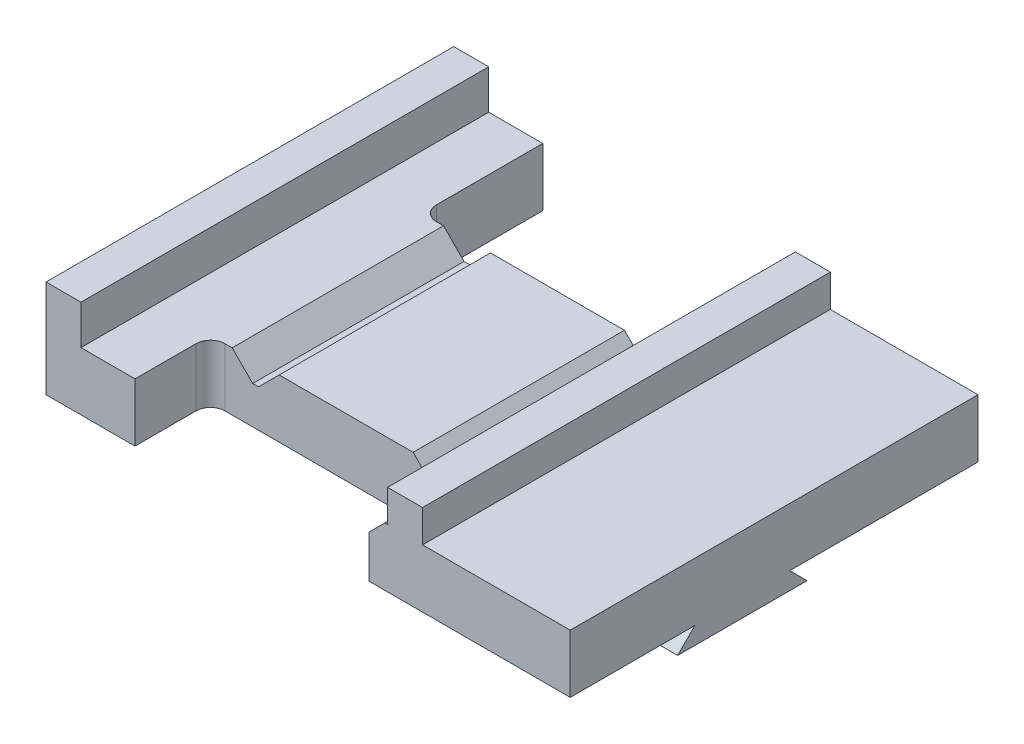
from build123d import *

# Parameters (mm, degrees)
BOSS_EXTRUDE1_DEPTH = 140
BOSS_EXTRUDE2_DEPTH = 180
CUT_EXTRUDE1_DEPTH  = 100


with BuildPart() as part:
    # Sketch1 → Boss-Extrude1 (new body)
    with BuildSketch(Plane.XY):
        Polygon((-151.904160434, 0.478889041), (-151.904160434, 20.590620884), (-139.904160434, 20.590620884), (-139.904160434, 7.071067812), (-113.904160434, 7.071067812), (-106.833092622, 0), (-104.833092622, 0), (-97.76202481, 7.071067812), (-51.76202481, 7.071067812), (-44.690956998, 0), (-42.690956998, 0), (-35.619889186, 7.071067812), (-34.619889186, 7.071067812), (-34.619889186, 18.180006359), (-22.619889186, 18.180006359), (-22.619889186, 7.071067812), (28.095839566, 7.071067812), (28.095839566, -12.928932188), (-151.904160434, -12.928932188), align=None)
    extrude(amount=BOSS_EXTRUDE1_DEPTH)

    # Sketch2 → Boss-Extrude2 (add)
    with BuildSketch(Plane(origin=(28.095839566, 0, 0), x_dir=(0, 0, -1), z_dir=(1, 0, 0))):
        Polygon((-97.181260036, -12.928932188), (-103.135086359, -18.882758511), (-58.679083955, -18.882758511), (-64.632910278, -12.928932188), align=None)
    extrude(amount=-BOSS_EXTRUDE2_DEPTH)

    # Sketch3 → Cut-Extrude1 (cut)
    with BuildSketch(Plane.XZ.offset(12.928932188)):
        with BuildLine():
            Line((-121.342924919, 0), (-41.039209534, 0))
            Line((-41.039209534, 0), (-41.039209534, 36.520193962))
            ThreePointArc((-41.039209534, 36.520193962), (-42.503675628, 40.055727868), (-46.039209534, 41.520193962))
            Line((-46.039209534, 41.520193962), (-116.342924919, 41.520193962))
            ThreePointArc((-116.342924919, 41.520193962), (-119.878458825, 40.055727868), (-121.342924919, 36.520193962))
            Line((-121.342924919, 36.520193962), (-121.342924919, 0))
        make_face()
        with BuildLine():
            Line((-121.342924919, 140), (-41.039209534, 140))
            Line((-41.039209534, 140), (-41.039209534, 119.087006536))
            ThreePointArc((-41.039209534, 119.087006536), (-42.503675628, 115.55147263), (-46.039209534, 114.087006536))
            Line((-46.039209534, 114.087006536), (-116.342924919, 114.087006536))
            ThreePointArc((-116.342924919, 114.087006536), (-119.878458825, 115.55147263), (-121.342924919, 119.087006536))
            Line((-121.342924919, 119.087006536), (-121.342924919, 140))
        make_face()
    extrude(amount=-CUT_EXTRUDE1_DEPTH, mode=Mode.SUBTRACT)


solid = part.part
